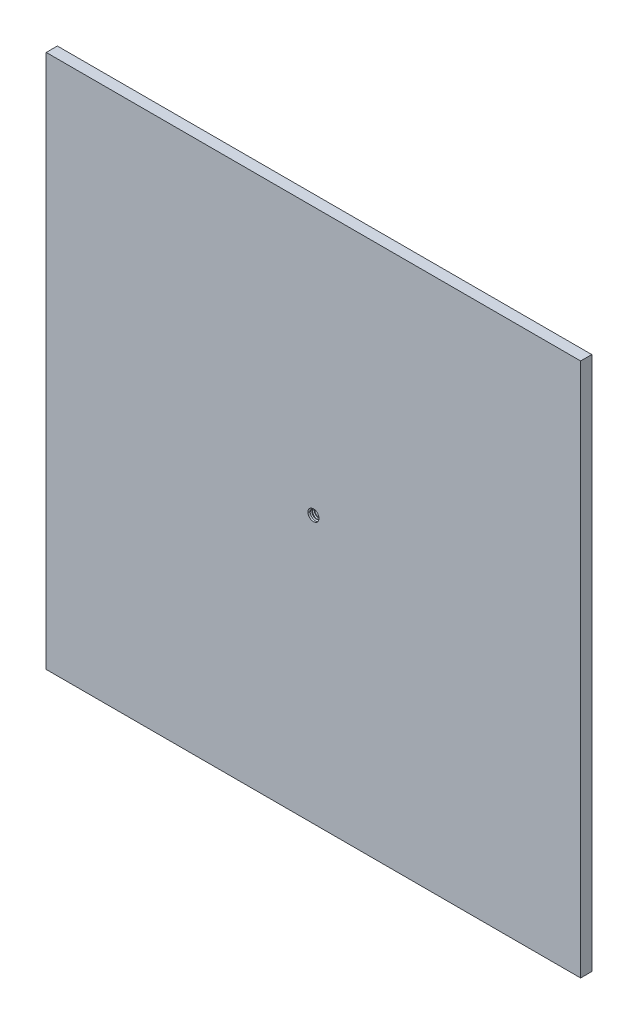
from build123d import *
from build123d.topology import SkipClean

# Parameters (mm, degrees)
SKETCH1_W           = 304.8
SKETCH1_H           = 304.8
BOSS_EXTRUDE1_DEPTH = 6.35
SKETCH2_R           = 3.175
CUT_EXTRUDE1_DEPTH  = 432.099063441
THREAD1_PITCH       = 1.27


with BuildPart() as part:
    # Sketch1 → Boss-Extrude1 (new body)
    with BuildSketch(Plane.XY):
        with Locations((152.4, 152.4)):
            Rectangle(SKETCH1_W, SKETCH1_H)
    extrude(amount=BOSS_EXTRUDE1_DEPTH)

    # Sketch2 → Cut-Extrude1 (cut, through all)
    with BuildSketch(Plane.XY.offset(6.35)):
        with Locations((152.4, 152.4)):
            Circle(SKETCH2_R)
    extrude(amount=-CUT_EXTRUDE1_DEPTH, mode=Mode.SUBTRACT)

    # Thread1: the profile of Thread Profile1 profile screwed along a right-hand helix of 7.874016 turns, 8 arcs to a turn; built about Z, then put on its axis
    with SkipClean():  # the faces are left unmerged after this step: merging them gives an invalid solid
        thread1_z = Axis((0, 0, 0), (0, 0, 1))
        thread1_corners = [(3.1753, 0, -0.000173205), (3.1753, 0, 1.111423202), (2.487592339, 0, 0.714374998), (2.487592339, 0, 0.396874998)]
        with BuildLine(mode=Mode.PRIVATE) as thread1_profile:
            Line(thread1_corners[0], thread1_corners[1])
            Line(thread1_corners[1], thread1_corners[2])
            Line(thread1_corners[2], thread1_corners[3])
            Line(thread1_corners[3], thread1_corners[0])
        thread1_cap = Face(thread1_profile.wire())
        thread1_turn_angles = [0, 22.5, 45, 67.5, 90, 112.5, 135, 157.5, 180, 202.5, 225, 247.5, 270, 292.5, 315, 337.5, 360]
        thread1_turn_weights = [1, 0.9238795325112867, 1, 0.9238795325112867, 1, 0.9238795325112867, 1, 0.9238795325112867, 1, 0.9238795325112867, 1, 0.9238795325112867, 1, 0.9238795325112867, 1, 0.9238795325112867, 1]
        thread1_turn_rails = [Edge.make_bspline([Vector(p[0], p[1], 0).rotate(thread1_z, thread1_turn_angles[k]) / thread1_turn_weights[k] + Vector(0, 0, p[2] + THREAD1_PITCH * thread1_turn_angles[k] / 360) for k in range(17)], [0, 0, 0, 1, 1, 2, 2, 3, 3, 4, 4, 5, 5, 6, 6, 7, 7, 8, 8, 8], 2, thread1_turn_weights) for p in thread1_corners]
        thread1_turn_sides = [Face.make_surface_from_curves(thread1_turn_rails[p[0]], thread1_turn_rails[p[1]]) for p in [(0, 1), (1, 2), (2, 3), (3, 0)]]
        thread1_last_angles = [2520, 2542.5, 2565, 2587.5, 2610, 2632.5, 2655, 2677.5, 2700, 2722.5, 2745, 2767.5, 2790, 2812.322834646, 2834.645669291]
        thread1_last_weights = [1, 0.9238795325112867, 1, 0.9238795325112867, 1, 0.9238795325112867, 1, 0.9238795325112867, 1, 0.9238795325112867, 1, 0.9238795325112867, 1, 0.9250584165493104, 1]
        thread1_last_rails = [Edge.make_bspline([Vector(p[0], p[1], 0).rotate(thread1_z, thread1_last_angles[k]) / thread1_last_weights[k] + Vector(0, 0, p[2] + THREAD1_PITCH * thread1_last_angles[k] / 360) for k in range(15)], [0, 0, 0, 1, 1, 2, 2, 3, 3, 4, 4, 5, 5, 6, 6, 7, 7, 7], 2, thread1_last_weights) for p in thread1_corners]
        thread1_last_sides = [Face.make_surface_from_curves(thread1_last_rails[p[0]], thread1_last_rails[p[1]]) for p in [(0, 1), (1, 2), (2, 3), (3, 0)]]
        thread1 = Plane(origin=(152.4, 152.4, 6.35), x_dir=(-1, 0, 0), z_dir=(0, 0, -1)) * Solid(Shell([*[p.moved(Location((0, 0, THREAD1_PITCH * i))) for i in range(7) for p in thread1_turn_sides], *thread1_last_sides, thread1_cap, thread1_cap.rotate(thread1_z, 2834.645669291).moved(Location((0, 0, THREAD1_PITCH * 2834.645669291 / 360)))]))
        add(thread1)


solid = part.part
